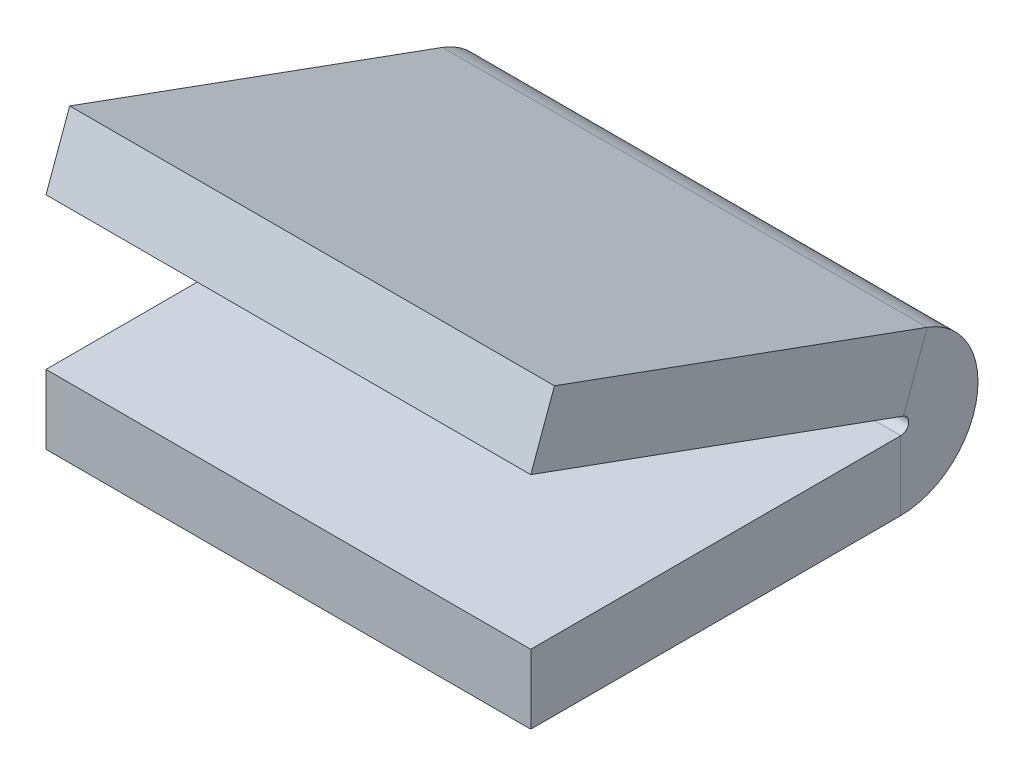
from build123d import *

# Parameters (mm, degrees)
BASE_FLANGE1_DEPTH = 44.45


# Sheet-metal steps are written as plain solids
with BuildPart() as part:
    # Sketch1 → Base-Flange1 (new body)
    with BuildSketch(Plane(origin=(0, 0, 0), x_dir=(0, 0, -1), z_dir=(1, 0, 0))):
        with BuildLine():
            Line((0, 0), (33.922533812, 0))
            ThreePointArc((33.922533812, 0), (34.647943203, 0.608690752), (34.174465849, 1.428777584))
            Line((34.174465849, 1.428777584), (0, 13.867265926))
            Line((0, 13.867265926), (2.17182791, 19.834314068))
            Line((2.17182791, 19.834314068), (36.346293759, 7.395825726))
            ThreePointArc((36.346293759, 7.395825726), (40.901472434, -0.493975176), (33.922533812, -6.35))
            Line((33.922533812, -6.35), (0, -6.35))
            Line((0, -6.35), (0, 0))
        make_face()
    extrude(amount=BASE_FLANGE1_DEPTH)


solid = part.part
